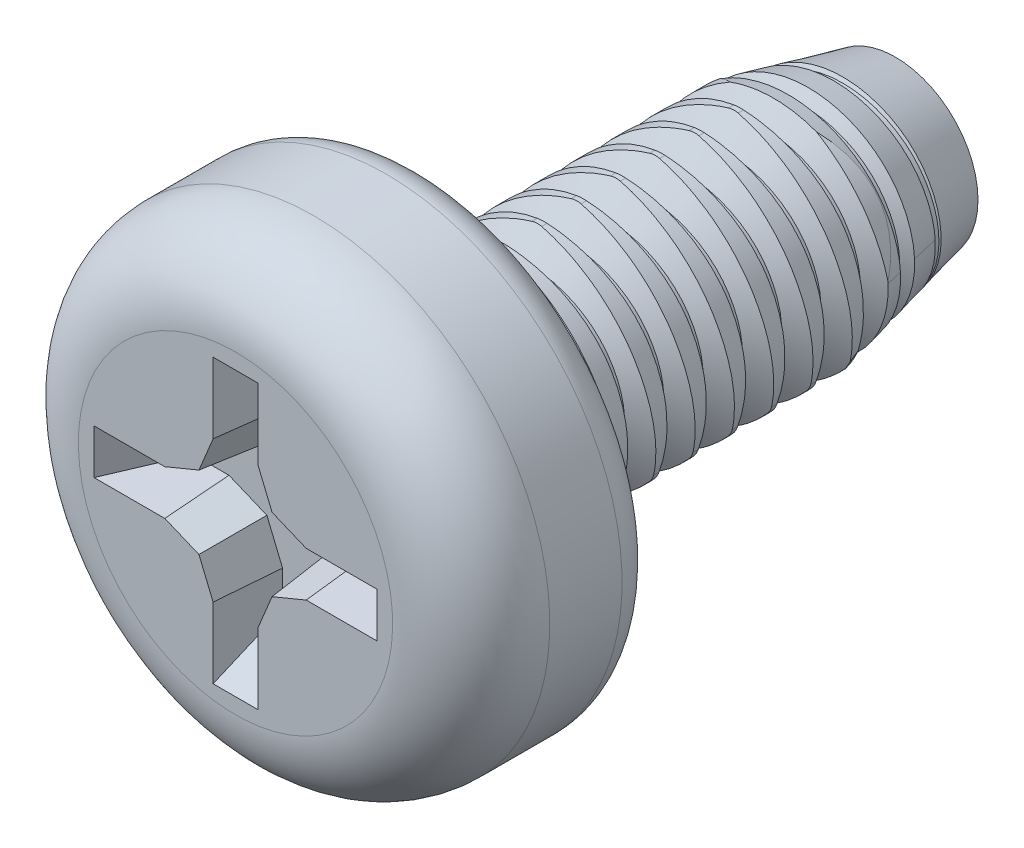
from build123d import *

# Parameters (mm, degrees)
SKETCH1_R          = 3
EXTRUDE3_DEPTH     = 2.4
SKETCH17_W         = 6
SKETCH17_H         = 1.5
CUT_EXTRUDE1_DEPTH = 0.8
CIRPATTERN1_COUNT  = 4
DRAFT1_START       = -0.285
DRAFT1_DEPTH       = 0.57
DRAFT1_2_DEPTH     = 0.57
DRAFT3_ANGLE       = 6
CUT_SWEEP1_PITCH   = 0.5
CUT_SWEEP1_TO      = 6
SKETCH18_OUTSIDE_W = 10.388
SKETCH18_OUTSIDE_H = 10.388
CUT_EXTRUDE3_DEPTH = 6


with BuildPart() as part:
    # Sketch1 → Extrude3 (new body)
    with BuildSketch(Plane.XY):
        Circle(SKETCH1_R)
    extrude(amount=EXTRUDE3_DEPTH)

    # Sketch11 → Cut-Revolve3 (revolve, cut)
    with BuildSketch(Plane(origin=(0, 0, 0), x_dir=(0, 0, -1), z_dir=(1, 0, 0))):
        with BuildLine():
            Line((-1.4, 3), (-0.48, 3))
            ThreePointArc((-0.48, 3), (-0.140588745, 2.859411255), (0, 2.52))
            Line((0, 2.52), (0.254, 2.52))
            Line((0.254, 2.52), (0.254, 3.254))
            Line((0.254, 3.254), (-2.654, 3.254))
            Line((-2.654, 3.254), (-2.654, 2))
            Line((-2.654, 2), (-2.4, 2))
            ThreePointArc((-2.4, 2), (-2.107106781, 2.707106781), (-1.4, 3))
        make_face()
    revolve(axis=Axis((0, 0, 0), (0, 0, 1)), mode=Mode.SUBTRACT)

    # Sketch12 → Cut-Extrude1 (cut)
    with BuildSketch(Plane.XY.offset(2.4)):
        Polygon((0, 1.8), (0, 0), (1.8, 0), (1.8, 0.285), (0.9, 0.285), (0.46512933, 0.46512933), (0.285, 0.9), (0.285, 1.8), align=None)
    cut_extrude1 = extrude(amount=-CUT_EXTRUDE1_DEPTH, mode=Mode.SUBTRACT)

    # CirPattern1: Cut-Extrude1 ×4 about axis
    cirpattern1_axis = Axis((0, 0, 0), (0, 0, 1))
    for i in range(1, CIRPATTERN1_COUNT):
        add(cut_extrude1.rotate(cirpattern1_axis, i * 360 / CIRPATTERN1_COUNT), mode=Mode.SUBTRACT)

    # Draft1: read off the stored shape, not the designer's step
    # Draft1 outline → Draft1 (add)
    with BuildSketch(Plane.YZ.offset(DRAFT1_START)):
        Polygon((1.8, 1.6), (1.8, 2.4), (1.338119785, 1.6), align=None)
        Polygon((-1.8, 1.6), (-1.338119785, 1.6), (-1.8, 2.4), align=None)
    extrude(amount=DRAFT1_DEPTH)

    # Draft1 2 outline → Draft1 2 (add)
    with BuildSketch(Plane(origin=(0, 0, 0), x_dir=(1, 0, 0), z_dir=(0, 1, 0)).offset(DRAFT1_START)):
        Polygon((1.8, -1.6), (1.338119785, -1.6), (1.8, -2.4), align=None)
        Polygon((-1.8, -2.4), (-1.338119785, -1.6), (-1.8, -1.6), align=None)
    extrude(amount=DRAFT1_2_DEPTH)

    # Draft3
    draft3_faces = [part.faces().sort_by_distance(p)[0] for p in [
        (-1.247815586, 0.285, 2.046022807),
        (-0.285, -1.247815586, 2.046022807),
        (-0.375064665, -0.682564665, 2),
        (-0.682564665, -0.375064665, 2),
        (-1.247815586, -0.285, 2.046022807),
        (0.285, -1.247815586, 2.046022807),
        (0.375064665, -0.682564665, 2),
        (0.682564665, -0.375064665, 2),
        (1.247815586, -0.285, 2.046022807),
        (1.247815586, 0.285, 2.046022807),
        (0.682564665, 0.375064665, 2),
        (0.375064665, 0.682564665, 2),
        (0.285, 1.247815586, 2.046022807),
        (-0.285, 1.247815586, 2.046022807),
        (-0.375064665, 0.682564665, 2),
        (-0.682564665, 0.375064665, 2),
    ]]
    draft(draft3_faces, Plane.XY.offset(2.4), DRAFT3_ANGLE)


with BuildPart() as body_2:
    # Sketch17 → Revolve1 (revolve)
    with BuildSketch(Plane(origin=(0, 0, 0), x_dir=(0, 0, -1), z_dir=(1, 0, 0))):
        with Locations((3, 0.75)):
            Rectangle(SKETCH17_W, SKETCH17_H)
    revolve(axis=Axis((0, 0, 0), (0, 0, 1)))


with BuildPart() as part_1:
    add(part.part)

    # Combine2: union body 2
    add(body_2.part)


with BuildPart() as body_2_2:
    # Split1: read off the stored shape, not the designer's step
    # Split1: the piece on the far side of the plane
    add(part_1.part)
    split(bisect_by=Plane.XY, keep=Keep.BOTTOM)

    # Cut-Sweep1: arcs per turn and ends read off the stored shape
    # Cut-Sweep1: the profile of Sketch21 screwed along a right-hand helix through 15 turns, 6 arcs to a turn; built about Z, then put on its axis
    cut_sweep1_z = Axis((0, 0, 0), (0, 0, 1))
    cut_sweep1_corners = [(1.5, 0, -0.9375), (1.175240474, 0, -0.75), (1.175240474, 0, -0.6875), (1.5, 0, -0.5), (1.6, 0, -0.442264973), (1.6, 0, -0.995235027)]
    with BuildLine(mode=Mode.PRIVATE) as cut_sweep1_profile:
        Line(cut_sweep1_corners[0], cut_sweep1_corners[1])
        Line(cut_sweep1_corners[1], cut_sweep1_corners[2])
        Line(cut_sweep1_corners[2], cut_sweep1_corners[3])
        Line(cut_sweep1_corners[3], cut_sweep1_corners[4])
        Line(cut_sweep1_corners[4], cut_sweep1_corners[5])
        Line(cut_sweep1_corners[5], cut_sweep1_corners[0])
    cut_sweep1_cap = Face(cut_sweep1_profile.wire())
    cut_sweep1_turn_angles = [0, 30, 60, 90, 120, 150, 180, 210, 240, 270, 300, 330, 360]
    cut_sweep1_turn_weights = [1, 0.8660254037844387, 1, 0.8660254037844387, 1, 0.8660254037844387, 1, 0.8660254037844387, 1, 0.8660254037844387, 1, 0.8660254037844387, 1]
    cut_sweep1_turn_rails = [Edge.make_bspline([Vector(p[0], p[1], 0).rotate(cut_sweep1_z, cut_sweep1_turn_angles[k]) / cut_sweep1_turn_weights[k] + Vector(0, 0, p[2] + CUT_SWEEP1_PITCH * cut_sweep1_turn_angles[k] / 360) for k in range(13)], [0, 0, 0, 1, 1, 2, 2, 3, 3, 4, 4, 5, 5, 6, 6, 6], 2, cut_sweep1_turn_weights) for p in cut_sweep1_corners]
    cut_sweep1_turn_sides = [Face.make_surface_from_curves(cut_sweep1_turn_rails[p[0]], cut_sweep1_turn_rails[p[1]]) for p in [(0, 1), (1, 2), (2, 3), (3, 4), (4, 5), (5, 0)]]
    cut_sweep1 = Plane(origin=(0, 0, -6), x_dir=(0, 1, 0), z_dir=(0, 0, 1)) * split(Solid(Shell([*[p.moved(Location((0, 0, CUT_SWEEP1_PITCH * i))) for i in range(15) for p in cut_sweep1_turn_sides], cut_sweep1_cap, cut_sweep1_cap.rotate(cut_sweep1_z, 5400).moved(Location((0, 0, CUT_SWEEP1_PITCH * 5400 / 360)))])), bisect_by=Plane.XY.offset(CUT_SWEEP1_TO), keep=Keep.BOTTOM, mode=Mode.PRIVATE)
    add(cut_sweep1, mode=Mode.SUBTRACT)

    # Sketch13 → Cut-Revolve4 (revolve, cut)
    with BuildSketch(Plane(origin=(0, 0, 0), x_dir=(0, 0, -1), z_dir=(1, 0, 0)), mode=Mode.PRIVATE) as cut_revolve4_sk:
        Polygon((6, 1.05), (4.08, 1.5), (6, 1.5), (8.54, 1.5), (8.54, 0), (6, 0), align=None)
    revolve(cut_revolve4_sk.sketch.rotate(Axis((0, 0, 0), (0, 0, -1)), 90), axis=Axis((0, 0, 0), (0, 0, -1)), mode=Mode.SUBTRACT)

    # Sketch18 outside → Cut-Extrude3 (cut)
    with BuildSketch(Plane(origin=(0, 0, -6), x_dir=(-1, 0, 0), z_dir=(0, 0, -1))):
        Rectangle(SKETCH18_OUTSIDE_W, SKETCH18_OUTSIDE_H)
        with BuildLine():
            ThreePointArc((-0.059792978, 1.493980951), (0, 1.5), (0.059792978, 1.493980951))
            ThreePointArc((0.059792978, 1.493980951), (1.184875346, 0.6840881), (1.323721946, -0.695208238))
            ThreePointArc((1.323721946, -0.695208238), (1.299038106, -0.75), (1.263928968, -0.798772714))
            ThreePointArc((1.263928968, -0.798772714), (0, -1.3681762), (-1.263928968, -0.798772714))
            ThreePointArc((-1.263928968, -0.798772714), (-1.299038106, -0.75), (-1.323721946, -0.695208238))
            ThreePointArc((-1.323721946, -0.695208238), (-1.184875346, 0.6840881), (-0.059792978, 1.493980951))
        make_face(mode=Mode.SUBTRACT)
    extrude(amount=-CUT_EXTRUDE3_DEPTH, mode=Mode.SUBTRACT)


with BuildPart() as part_2:
    add(part_1.part)

    # Split1
    split(bisect_by=Plane.XY, keep=Keep.TOP)

    # Combine1: union body 2 2
    add(body_2_2.part)


solid = part_2.part
